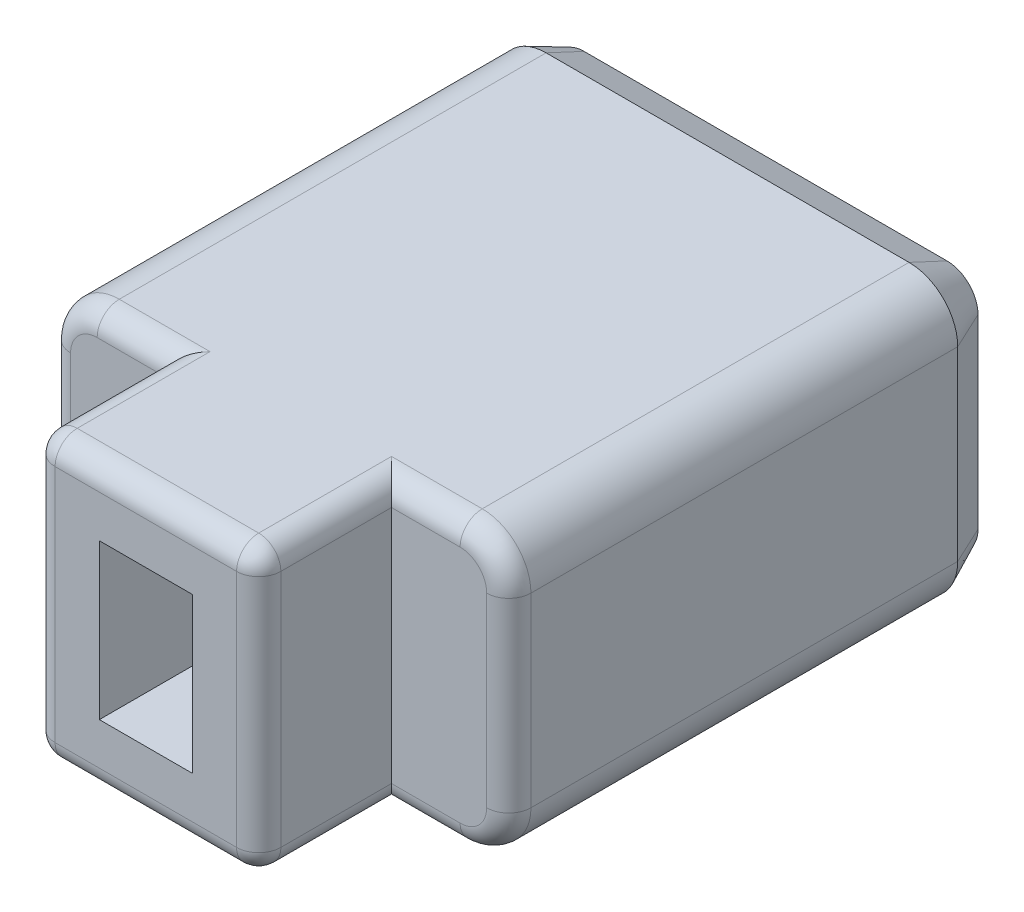
from build123d import *

# Parameters (mm, degrees)
BOSS_EXTRU_1_DEPTH      = 14
ESQUISSE3_W             = 2.1
ESQUISSE3_H             = 3.5
ENL_V_MAT_EXTRU_1_DEPTH = 3
ESQUISSE4_OUTSIDE_W     = 16.116
ESQUISSE4_OUTSIDE_H     = 12.116
ESQUISSE4_OUTSIDE_W_2   = 5.1
ESQUISSE4_OUTSIDE_H_2   = 6.4
ENL_V_MAT_EXTRU_2_DEPTH = 3
CONG_1_R                = 0.5
CHANFREIN1_SIZE         = 0.4
CHANFREIN1_SIZE2        = 0.857802768
ESQUISSE5_W             = 0.367948718
ESQUISSE5_H             = 4.1
ENL_V_MAT_EXTRU_3_DEPTH = 0.3
ESQUISSE5_2_W           = 0.367948718
ESQUISSE5_2_H           = 4.1
BOSS_EXTRU_2_DEPTH      = 0.3
BOSS_EXTRU_2_2_DEPTH    = 0.3
BOSS_EXTRU_2_3_DEPTH    = 0.3


with BuildPart() as part:
    # Esquisse2 → Boss.-Extru.1 (new body)
    with BuildSketch(Plane.XY):
        with BuildLine():
            Line((1.1, 0), (9.3, 0))
            ThreePointArc((9.3, 0), (10.077817459, 0.322182541), (10.4, 1.1))
            Line((10.4, 1.1), (10.4, 5.3))
            ThreePointArc((10.4, 5.3), (10.077817459, 6.077817459), (9.3, 6.4))
            Line((9.3, 6.4), (1.1, 6.4))
            ThreePointArc((1.1, 6.4), (0.322182541, 6.077817459), (0, 5.3))
            Line((0, 5.3), (0, 1.1))
            ThreePointArc((0, 1.1), (0.322182541, 0.322182541), (1.1, 0))
        make_face()
    extrude(amount=BOSS_EXTRU_1_DEPTH)

    # Esquisse3 → Enlèv. mat.-Extru.1 (cut)
    with BuildSketch(Plane.XY.offset(14)):
        with Locations((5.2, 3.2)):
            Rectangle(ESQUISSE3_W, ESQUISSE3_H)
    extrude(amount=-ENL_V_MAT_EXTRU_1_DEPTH, mode=Mode.SUBTRACT)

    # Esquisse4 outside → Enlèv. mat.-Extru.2 (cut)
    with BuildSketch(Plane.XY.offset(14)):
        with Locations((5.2, 3.2)):
            Rectangle(ESQUISSE4_OUTSIDE_W, ESQUISSE4_OUTSIDE_H)
        with Locations((5.2, 3.2)):
            Rectangle(ESQUISSE4_OUTSIDE_W_2, ESQUISSE4_OUTSIDE_H_2, mode=Mode.SUBTRACT)
    extrude(amount=-ENL_V_MAT_EXTRU_2_DEPTH, mode=Mode.SUBTRACT)

    # Congé1
    cong_1_edges = [part.edges().sort_by_distance(p)[0] for p in [
        (8.525, 0, 11),
        (10.077817459, 0.322182541, 11),
        (10.4, 3.2, 11),
        (10.077817459, 6.077817459, 11),
        (1.875, 6.4, 11),
        (0.322182541, 6.077817459, 11),
        (1.875, 0, 11),
        (0.322182541, 0.322182541, 11),
        (7.75, 6.4, 12.5),
        (2.65, 6.4, 12.5),
        (7.75, 0, 12.5),
        (2.65, 0, 12.5),
        (2.65, 3.2, 14),
        (5.2, 6.4, 14),
        (7.75, 3.2, 14),
        (5.2, 0, 14),
        (8.525, 6.4, 11),
        (0, 3.2, 11),
    ]]
    fillet(cong_1_edges, radius=CONG_1_R)

    # Chanfrein1
    chanfrein1_edges = [part.edges().sort_by_distance(p)[0] for p in [
        (5.2, 0, 0),
        (10.077817459, 0.322182541, 0),
        (0.322182541, 0.322182541, 0),
        (10.4, 3.2, 0),
        (0, 3.2, 0),
        (10.077817459, 6.077817459, 0),
        (0.322182541, 6.077817459, 0),
        (5.2, 6.4, 0),
    ]]
    chanfrein1_side = [part.faces().sort_by_distance(p)[0] for p in [
        (5.2, 3.2, 0),
    ]]
    chamfer(chanfrein1_edges, length=CHANFREIN1_SIZE, length2=CHANFREIN1_SIZE2, reference=chanfrein1_side[0])

    # Esquisse5 → Enlèv. mat.-Extru.3 (cut)
    # profile 1 of 3: a face of its own
    with BuildSketch(Plane(origin=(0, 0, 0), x_dir=(-1, 0, 0), z_dir=(0, 0, -1))):
        with Locations((-1.941025641, 3.25)):
            Rectangle(ESQUISSE5_W, ESQUISSE5_H)
    # profile 2 of 3: a face of its own
    with BuildSketch(Plane(origin=(0, 0, 0), x_dir=(-1, 0, 0), z_dir=(0, 0, -1))):
        with BuildLine():
            Line((-3.018589744, 5.3), (-3.018589744, 1.2))
            Line((-3.018589744, 1.2), (-3.846474359, 1.2))
            add(Edge.make_bspline(
                [(-3.846474359, 1.2), (-3.918481038, 1.200517026), (-4.057597566, 1.201515919), (-4.258627285, 1.207885614), (-4.444365827, 1.219039841), (-4.614707713, 1.235600692), (-4.76992661, 1.255478355), (-4.909773919, 1.280757779), (-5.034476271, 1.310488093), (-5.111168895, 1.335845385), (-5.147435897, 1.347836538)],
                knots=[0, 0, 0, 0, 1.314317071, 2.539253741, 3.67075822, 4.709970291, 5.662644612, 6.526156501, 7.303037452, 8, 8, 8, 8], degree=3))
            add(Edge.make_bspline(
                [(-5.147435897, 1.347836538), (-5.194876834, 1.365906899), (-5.288682905, 1.401637845), (-5.422172522, 1.469142364), (-5.548264277, 1.545315195), (-5.665962542, 1.631902715), (-5.775526661, 1.727798439), (-5.878335188, 1.832226494), (-5.971441307, 1.947974756), (-6.058056276, 2.071451599), (-6.133866846, 2.203780688), (-6.200717201, 2.34231149), (-6.257797254, 2.486775214), (-6.302335028, 2.638225945), (-6.339130926, 2.795209059), (-6.363820071, 2.958913108), (-6.380220077, 3.128383688), (-6.381860147, 3.243389539), (-6.382692308, 3.301742788)],
                knots=[0, 0, 0, 0, 0.984696416, 1.947063185, 2.89840987, 3.841051395, 4.778753227, 5.721858861, 6.681155121, 7.65838316, 8.646299769, 9.637283673, 10.641736726, 11.657050558, 12.698485921, 13.768600492, 14.86780186, 16, 16, 16, 16], degree=3))
            add(Edge.make_bspline(
                [(-6.382692308, 3.301742788), (-6.38195502, 3.352420067), (-6.380502118, 3.452284939), (-6.367472035, 3.599466733), (-6.348496631, 3.742270786), (-6.319253431, 3.880070059), (-6.283320065, 4.013792315), (-6.23896913, 4.142804399), (-6.18640201, 4.267193997), (-6.125439081, 4.385973114), (-6.058687162, 4.498852926), (-5.985949986, 4.604044923), (-5.909718031, 4.702708892), (-5.827210978, 4.792615906), (-5.741160551, 4.876565695), (-5.648640057, 4.950834238), (-5.55254642, 5.018869439), (-5.44999271, 5.078605183), (-5.340137512, 5.131741903), (-5.220111251, 5.176616182), (-5.09035199, 5.215233842), (-4.949999918, 5.246001751), (-4.799523123, 5.270802246), (-4.638513695, 5.287318103), (-4.467273135, 5.298517915), (-4.34968561, 5.299496379), (-4.28916266, 5.3)],
                knots=[0, 0, 0, 0, 1.105894396, 2.179280415, 3.222964075, 4.248423888, 5.251546139, 6.243661943, 7.223682738, 8.196462441, 9.155694589, 10.083899862, 10.986397372, 11.874737962, 12.745335529, 13.607670254, 14.461432187, 15.313100333, 16.195087267, 17.121790994, 18.106827133, 19.14775296, 20.255889161, 21.433815148, 22.679170477, 24, 24, 24, 24], degree=3))
            Line((-4.28916266, 5.3), (-3.018589744, 5.3))
        make_face()
        with BuildLine():
            Line((-3.386538462, 4.879487179), (-3.857151442, 4.879487179))
            add(Edge.make_bspline(
                [(-3.857151442, 4.879487179), (-3.924776105, 4.879196552), (-4.054843098, 4.87863757), (-4.241871037, 4.87373256), (-4.41275833, 4.865717719), (-4.567529241, 4.8545012), (-4.706096384, 4.839660822), (-4.828749348, 4.823114507), (-4.935086079, 4.802500351), (-4.999431991, 4.783814941), (-5.029166667, 4.775180288)],
                knots=[0, 0, 0, 0, 1.375205317, 2.645023457, 3.804390687, 4.853969522, 5.800190428, 6.637939096, 7.370582563, 8, 8, 8, 8], degree=3))
            add(Edge.make_bspline(
                [(-5.029166667, 4.775180288), (-5.066592686, 4.762000876), (-5.140550805, 4.735956842), (-5.247000006, 4.6884322), (-5.346329209, 4.632206883), (-5.440194337, 4.569339124), (-5.52799215, 4.498858185), (-5.609316063, 4.42053992), (-5.684808433, 4.335291035), (-5.753260557, 4.242824282), (-5.815170072, 4.144165625), (-5.86865969, 4.039424964), (-5.913750832, 3.929190063), (-5.950745116, 3.81384445), (-5.979587972, 3.693319475), (-5.999894478, 3.56731268), (-6.012478182, 3.435873827), (-6.01398022, 3.346396066), (-6.01474359, 3.300921474)],
                knots=[0, 0, 0, 0, 0.998420628, 1.972994, 2.929372424, 3.86770908, 4.81360496, 5.759023883, 6.706048443, 7.676227424, 8.651287839, 9.634325482, 10.632389399, 11.645655052, 12.680158286, 13.74837235, 14.855672678, 16, 16, 16, 16], degree=3))
            add(Edge.make_bspline(
                [(-6.01474359, 3.300921474), (-6.014141669, 3.252971113), (-6.012959192, 3.158772204), (-5.998121227, 3.020550462), (-5.976391629, 2.887630733), (-5.945135298, 2.75991732), (-5.904754812, 2.637576382), (-5.856436288, 2.519916744), (-5.797770016, 2.408452573), (-5.731353593, 2.302239812), (-5.656788995, 2.202886984), (-5.574406987, 2.111558061), (-5.485076237, 2.02808292), (-5.389208443, 1.952328654), (-5.285463211, 1.885642449), (-5.175596116, 1.826319442), (-5.058059531, 1.775915087), (-4.976277405, 1.7491161), (-4.934715545, 1.735496795)],
                knots=[0, 0, 0, 0, 1.122272916, 2.204715076, 3.251197285, 4.274229216, 5.279697671, 6.265416158, 7.248880903, 8.225321784, 9.195852973, 10.153576302, 11.101466393, 12.055578741, 13.010401466, 13.985536859, 14.976245305, 16, 16, 16, 16], degree=3))
            add(Edge.make_bspline(
                [(-4.934715545, 1.735496795), (-4.900332773, 1.725988979), (-4.827225568, 1.705772755), (-4.70792791, 1.683720176), (-4.573664449, 1.664269191), (-4.423839085, 1.647801202), (-4.258622604, 1.635984626), (-4.077887941, 1.627115371), (-3.881556976, 1.621133316), (-3.745457436, 1.620724831), (-3.674819712, 1.620512821)],
                knots=[0, 0, 0, 0, 0.674548936, 1.434276114, 2.292660221, 3.240891867, 4.284742987, 5.42552168, 6.663806718, 8, 8, 8, 8], degree=3))
            Line((-3.674819712, 1.620512821), (-3.386538462, 1.620512821))
            Line((-3.386538462, 1.620512821), (-3.386538462, 4.879487179))
        make_face(mode=Mode.SUBTRACT)
    # profile 3 of 3: a face of its own
    with BuildSketch(Plane(origin=(0, 0, 0), x_dir=(-1, 0, 0), z_dir=(0, 0, -1))):
        Polygon((-6.750641026, 1.620512821), (-6.750641026, 1.2), (-8.905769231, 1.2), (-8.905769231, 1.620512821), (-8.012179487, 1.620512821), (-8.012179487, 5.3), (-7.644230769, 5.3), (-7.644230769, 1.620512821), align=None)
    extrude(amount=-ENL_V_MAT_EXTRU_3_DEPTH, mode=Mode.SUBTRACT)


with BuildPart() as body_2:
    # Esquisse5<2> → Boss.-Extru.2 (new body)
    with BuildSketch(Plane(origin=(0, 0, 0), x_dir=(-1, 0, 0), z_dir=(0, 0, -1))):
        with Locations((-1.941025641, 3.25)):
            Rectangle(ESQUISSE5_2_W, ESQUISSE5_2_H)
    extrude(amount=BOSS_EXTRU_2_DEPTH)


with BuildPart() as body_3:
    # Esquisse5<2> → Boss.-Extru.2 2 (new body)
    with BuildSketch(Plane(origin=(0, 0, 0), x_dir=(-1, 0, 0), z_dir=(0, 0, -1))):
        with BuildLine():
            Line((-3.018589744, 5.3), (-3.018589744, 1.2))
            Line((-3.018589744, 1.2), (-3.846474359, 1.2))
            add(Edge.make_bspline(
                [(-3.846474359, 1.2), (-3.918481038, 1.200517026), (-4.057597566, 1.201515919), (-4.258627285, 1.207885614), (-4.444365827, 1.219039841), (-4.614707713, 1.235600692), (-4.76992661, 1.255478355), (-4.909773919, 1.280757779), (-5.034476271, 1.310488093), (-5.111168895, 1.335845385), (-5.147435897, 1.347836538)],
                knots=[0, 0, 0, 0, 1.314317071, 2.539253741, 3.67075822, 4.709970291, 5.662644612, 6.526156501, 7.303037452, 8, 8, 8, 8], degree=3))
            add(Edge.make_bspline(
                [(-5.147435897, 1.347836538), (-5.194876834, 1.365906899), (-5.288682905, 1.401637845), (-5.422172522, 1.469142364), (-5.548264277, 1.545315195), (-5.665962542, 1.631902715), (-5.775526661, 1.727798439), (-5.878335188, 1.832226494), (-5.971441307, 1.947974756), (-6.058056276, 2.071451599), (-6.133866846, 2.203780688), (-6.200717201, 2.34231149), (-6.257797254, 2.486775214), (-6.302335028, 2.638225945), (-6.339130926, 2.795209059), (-6.363820071, 2.958913108), (-6.380220077, 3.128383688), (-6.381860147, 3.243389539), (-6.382692308, 3.301742788)],
                knots=[0, 0, 0, 0, 0.984696416, 1.947063185, 2.89840987, 3.841051395, 4.778753227, 5.721858861, 6.681155121, 7.65838316, 8.646299769, 9.637283673, 10.641736726, 11.657050558, 12.698485921, 13.768600492, 14.86780186, 16, 16, 16, 16], degree=3))
            add(Edge.make_bspline(
                [(-6.382692308, 3.301742788), (-6.38195502, 3.352420067), (-6.380502118, 3.452284939), (-6.367472035, 3.599466733), (-6.348496631, 3.742270786), (-6.319253431, 3.880070059), (-6.283320065, 4.013792315), (-6.23896913, 4.142804399), (-6.18640201, 4.267193997), (-6.125439081, 4.385973114), (-6.058687162, 4.498852926), (-5.985949986, 4.604044923), (-5.909718031, 4.702708892), (-5.827210978, 4.792615906), (-5.741160551, 4.876565695), (-5.648640057, 4.950834238), (-5.55254642, 5.018869439), (-5.44999271, 5.078605183), (-5.340137512, 5.131741903), (-5.220111251, 5.176616182), (-5.09035199, 5.215233842), (-4.949999918, 5.246001751), (-4.799523123, 5.270802246), (-4.638513695, 5.287318103), (-4.467273135, 5.298517915), (-4.34968561, 5.299496379), (-4.28916266, 5.3)],
                knots=[0, 0, 0, 0, 1.105894396, 2.179280415, 3.222964075, 4.248423888, 5.251546139, 6.243661943, 7.223682738, 8.196462441, 9.155694589, 10.083899862, 10.986397372, 11.874737962, 12.745335529, 13.607670254, 14.461432187, 15.313100333, 16.195087267, 17.121790994, 18.106827133, 19.14775296, 20.255889161, 21.433815148, 22.679170477, 24, 24, 24, 24], degree=3))
            Line((-4.28916266, 5.3), (-3.018589744, 5.3))
        make_face()
        with BuildLine():
            Line((-3.386538462, 4.879487179), (-3.857151442, 4.879487179))
            add(Edge.make_bspline(
                [(-3.857151442, 4.879487179), (-3.924776105, 4.879196552), (-4.054843098, 4.87863757), (-4.241871037, 4.87373256), (-4.41275833, 4.865717719), (-4.567529241, 4.8545012), (-4.706096384, 4.839660822), (-4.828749348, 4.823114507), (-4.935086079, 4.802500351), (-4.999431991, 4.783814941), (-5.029166667, 4.775180288)],
                knots=[0, 0, 0, 0, 1.375205317, 2.645023457, 3.804390687, 4.853969522, 5.800190428, 6.637939096, 7.370582563, 8, 8, 8, 8], degree=3))
            add(Edge.make_bspline(
                [(-5.029166667, 4.775180288), (-5.066592686, 4.762000876), (-5.140550805, 4.735956842), (-5.247000006, 4.6884322), (-5.346329209, 4.632206883), (-5.440194337, 4.569339124), (-5.52799215, 4.498858185), (-5.609316063, 4.42053992), (-5.684808433, 4.335291035), (-5.753260557, 4.242824282), (-5.815170072, 4.144165625), (-5.86865969, 4.039424964), (-5.913750832, 3.929190063), (-5.950745116, 3.81384445), (-5.979587972, 3.693319475), (-5.999894478, 3.56731268), (-6.012478182, 3.435873827), (-6.01398022, 3.346396066), (-6.01474359, 3.300921474)],
                knots=[0, 0, 0, 0, 0.998420628, 1.972994, 2.929372424, 3.86770908, 4.81360496, 5.759023883, 6.706048443, 7.676227424, 8.651287839, 9.634325482, 10.632389399, 11.645655052, 12.680158286, 13.74837235, 14.855672678, 16, 16, 16, 16], degree=3))
            add(Edge.make_bspline(
                [(-6.01474359, 3.300921474), (-6.014141669, 3.252971113), (-6.012959192, 3.158772204), (-5.998121227, 3.020550462), (-5.976391629, 2.887630733), (-5.945135298, 2.75991732), (-5.904754812, 2.637576382), (-5.856436288, 2.519916744), (-5.797770016, 2.408452573), (-5.731353593, 2.302239812), (-5.656788995, 2.202886984), (-5.574406987, 2.111558061), (-5.485076237, 2.02808292), (-5.389208443, 1.952328654), (-5.285463211, 1.885642449), (-5.175596116, 1.826319442), (-5.058059531, 1.775915087), (-4.976277405, 1.7491161), (-4.934715545, 1.735496795)],
                knots=[0, 0, 0, 0, 1.122272916, 2.204715076, 3.251197285, 4.274229216, 5.279697671, 6.265416158, 7.248880903, 8.225321784, 9.195852973, 10.153576302, 11.101466393, 12.055578741, 13.010401466, 13.985536859, 14.976245305, 16, 16, 16, 16], degree=3))
            add(Edge.make_bspline(
                [(-4.934715545, 1.735496795), (-4.900332773, 1.725988979), (-4.827225568, 1.705772755), (-4.70792791, 1.683720176), (-4.573664449, 1.664269191), (-4.423839085, 1.647801202), (-4.258622604, 1.635984626), (-4.077887941, 1.627115371), (-3.881556976, 1.621133316), (-3.745457436, 1.620724831), (-3.674819712, 1.620512821)],
                knots=[0, 0, 0, 0, 0.674548936, 1.434276114, 2.292660221, 3.240891867, 4.284742987, 5.42552168, 6.663806718, 8, 8, 8, 8], degree=3))
            Line((-3.674819712, 1.620512821), (-3.386538462, 1.620512821))
            Line((-3.386538462, 1.620512821), (-3.386538462, 4.879487179))
        make_face(mode=Mode.SUBTRACT)
    extrude(amount=BOSS_EXTRU_2_2_DEPTH)


with BuildPart() as body_4:
    # Esquisse5<2> → Boss.-Extru.2 3 (new body)
    with BuildSketch(Plane(origin=(0, 0, 0), x_dir=(-1, 0, 0), z_dir=(0, 0, -1))):
        Polygon((-6.750641026, 1.620512821), (-6.750641026, 1.2), (-8.905769231, 1.2), (-8.905769231, 1.620512821), (-8.012179487, 1.620512821), (-8.012179487, 5.3), (-7.644230769, 5.3), (-7.644230769, 1.620512821), align=None)
    extrude(amount=BOSS_EXTRU_2_3_DEPTH)


solid = Compound([part.part, body_2.part, body_3.part, body_4.part])
